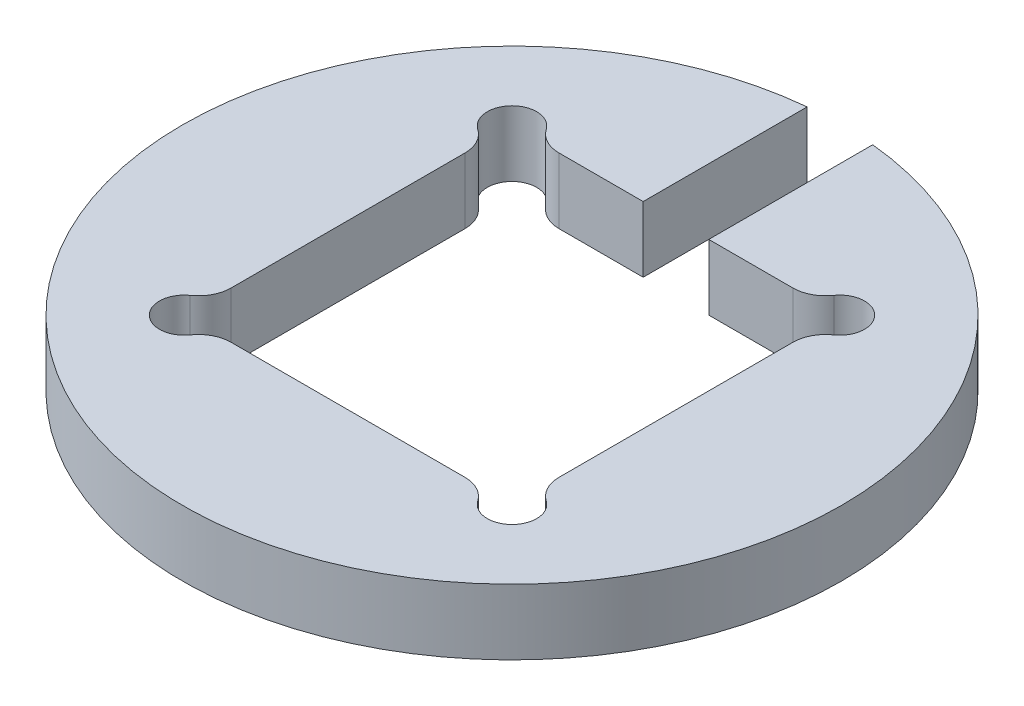
from build123d import *

# Parameters (mm, degrees)
BOSS_EXTRUDE1_DEPTH = 4
FILLET1_R           = 2


with BuildPart() as part:
    # Sketch1 → Boss-Extrude1 (new body)
    with BuildSketch(Plane(origin=(0, 0, 0), x_dir=(1, 0, 0), z_dir=(0, 1, 0))):
        with BuildLine():
            ThreePointArc((1.5, 0), (-1.060660172, -1.060660172), (0, 1.5))
            Line((0, 1.5), (0, 18.5))
            ThreePointArc((0, 18.5), (-1.060660172, 21.060660172), (1.5, 20))
            Line((1.5, 20), (8, 20))
            Line((8, 20), (8, 30))
            ThreePointArc((8, 30), (10, -10.099751242), (12, 30))
            Line((12, 30), (12, 20))
            Line((12, 20), (18.5, 20))
            ThreePointArc((18.5, 20), (21.060660172, 21.060660172), (20, 18.5))
            Line((20, 18.5), (20, 1.5))
            ThreePointArc((20, 1.5), (21.060660172, -1.060660172), (18.5, 0))
            Line((18.5, 0), (1.5, 0))
        make_face()
    extrude(amount=BOSS_EXTRUDE1_DEPTH)

    # Fillet1
    fillet1_edges = [part.edges().sort_by_distance(p)[0] for p in [
        (18.5, 2, 0),
        (20, 2, -1.5),
        (20, 2, -18.5),
        (0, 2, -1.5),
        (1.5, 2, 0),
        (0, 2, -18.5),
        (18.5, 2, -20),
        (1.5, 2, -20),
    ]]
    fillet(fillet1_edges, radius=FILLET1_R)


solid = part.part
